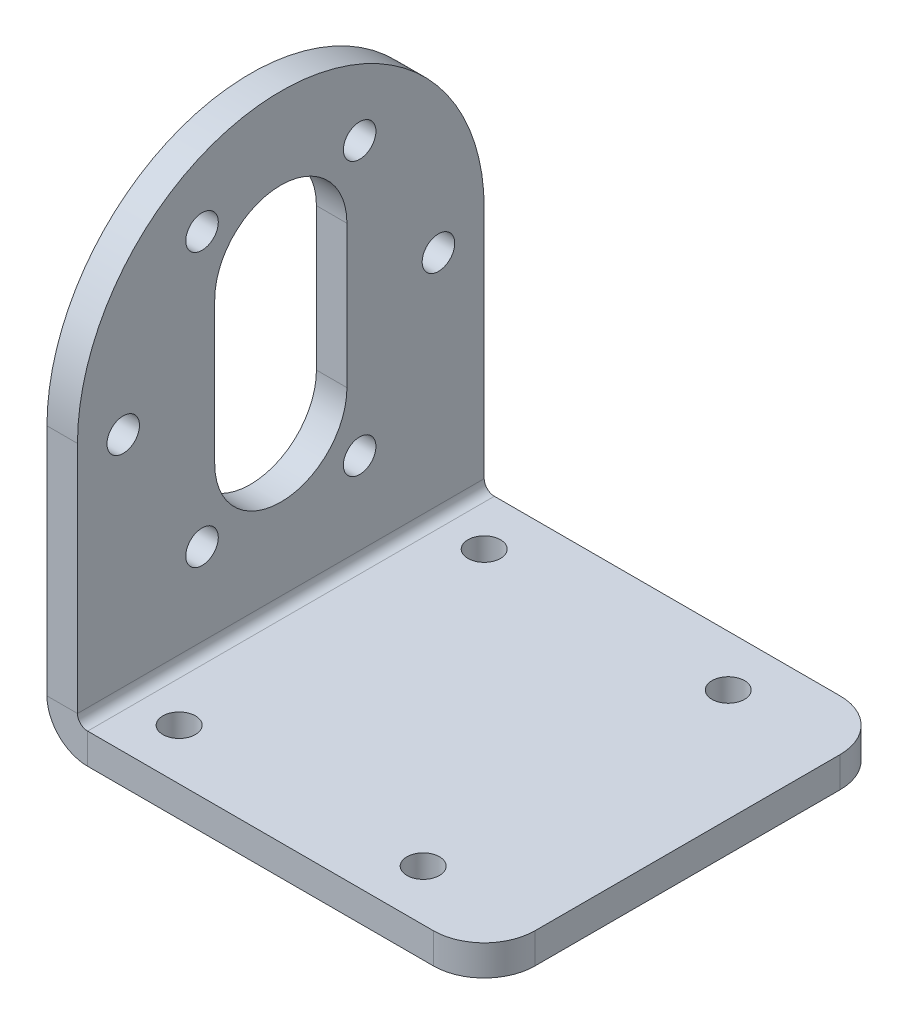
from build123d import *

# Parameters (mm, degrees)
SM_BASE_FLANGE_1_DEPTH      = 40
CUT_EXTRUDE_3_DEPTH         = 10
CUT_EXTRUDE_1_DEPTH         = 76.219678276
SKETCH_7_R                  = 1.6
CUT_EXTRUDE_2_DEPTH         = 76.219678276
SKETCH_9_R                  = 1.6
CUT_EXTRUDE_4_DEPTH         = 76.219678276
PATTERN_LINEAR_1_COUNT      = 2
PATTERN_LINEAR_1_PITCH      = 30
PATTERN_LINEAR_1_COUNT_DIR2 = 2
PATTERN_LINEAR_1_PITCH_DIR2 = 24
FILLET_1_R                  = 5


# Sheet-metal steps are written as plain solids
with BuildPart() as part:
    # Sketch 1 → 基材-凸緣1 (new body)
    with BuildSketch(Plane.XY):
        with BuildLine():
            Line((43, 0), (4, 0))
            ThreePointArc((4, 0), (1.171572875, 1.171572875), (0, 4))
            Line((0, 4), (0, 47))
            Line((0, 47), (3, 47))
            Line((3, 47), (3, 4))
            ThreePointArc((3, 4), (3.292893219, 3.292893219), (4, 3))
            Line((4, 3), (43, 3))
            Line((43, 3), (43, 0))
        make_face()
    extrude(amount=SM_BASE_FLANGE_1_DEPTH)

    # 草圖8 → 除料-伸長3 (cut)
    with BuildSketch(Plane.ZY):
        with BuildLine():
            Line((0, 47), (0, 27))
            ThreePointArc((0, 27), (5.857864376, 41.142135624), (20, 47))
            Line((20, 47), (0, 47))
        make_face()
        with BuildLine():
            ThreePointArc((20, 47), (34.142135624, 41.142135624), (40, 27))
            Line((40, 27), (40, 47))
            Line((40, 47), (20, 47))
        make_face()
    extrude(amount=-CUT_EXTRUDE_3_DEPTH, mode=Mode.SUBTRACT)

    # 草圖6 → 除料-伸長1 (cut, through all)
    with BuildSketch(Plane.ZY):
        with BuildLine():
            Line((26.5, 32.5), (26.5, 18.5))
            ThreePointArc((26.5, 18.5), (20, 12), (13.5, 18.5))
            Line((13.5, 18.5), (13.5, 32.5))
            ThreePointArc((13.5, 32.5), (20, 39), (26.5, 32.5))
        make_face()
    extrude(amount=-CUT_EXTRUDE_1_DEPTH, mode=Mode.SUBTRACT)

    # 草圖7 → 除料-伸長2 (cut, through all)
    with BuildSketch(Plane.ZY):
        with Locations((4.5, 25.5)):
            Circle(SKETCH_7_R)
        with Locations((12.25, 12.076606241)):
            Circle(SKETCH_7_R)
        with Locations((27.75, 12.076606241)):
            Circle(SKETCH_7_R)
        with Locations((35.5, 25.5)):
            Circle(SKETCH_7_R)
        with Locations((27.75, 38.923393759)):
            Circle(SKETCH_7_R)
        with Locations((12.25, 38.923393759)):
            Circle(SKETCH_7_R)
    extrude(amount=-CUT_EXTRUDE_2_DEPTH, mode=Mode.SUBTRACT)

    # 草圖9 → 除料-伸長4 (cut, through all)
    with BuildSketch(Plane.XZ):
        with Locations(Location((32, 35, 0), (0, 0, 270))):
            Circle(SKETCH_9_R)
    cut_extrude_4 = extrude(amount=-CUT_EXTRUDE_4_DEPTH, mode=Mode.SUBTRACT)

    # 直線複製排列1: Cut-Extrude 4 2 × 2
    with Locations(*[(-j * PATTERN_LINEAR_1_PITCH_DIR2, 0, -i * PATTERN_LINEAR_1_PITCH) for i in range(PATTERN_LINEAR_1_COUNT) for j in range(PATTERN_LINEAR_1_COUNT_DIR2) if (i, j) != (0, 0)]):
        add(cut_extrude_4, mode=Mode.SUBTRACT)

    # 圓角1
    fillet_1_edges = [part.edges().sort_by_distance(p)[0] for p in [
        (43, 1.5, 40),
        (43, 1.5, 0),
    ]]
    fillet(fillet_1_edges, radius=FILLET_1_R)


solid = part.part
